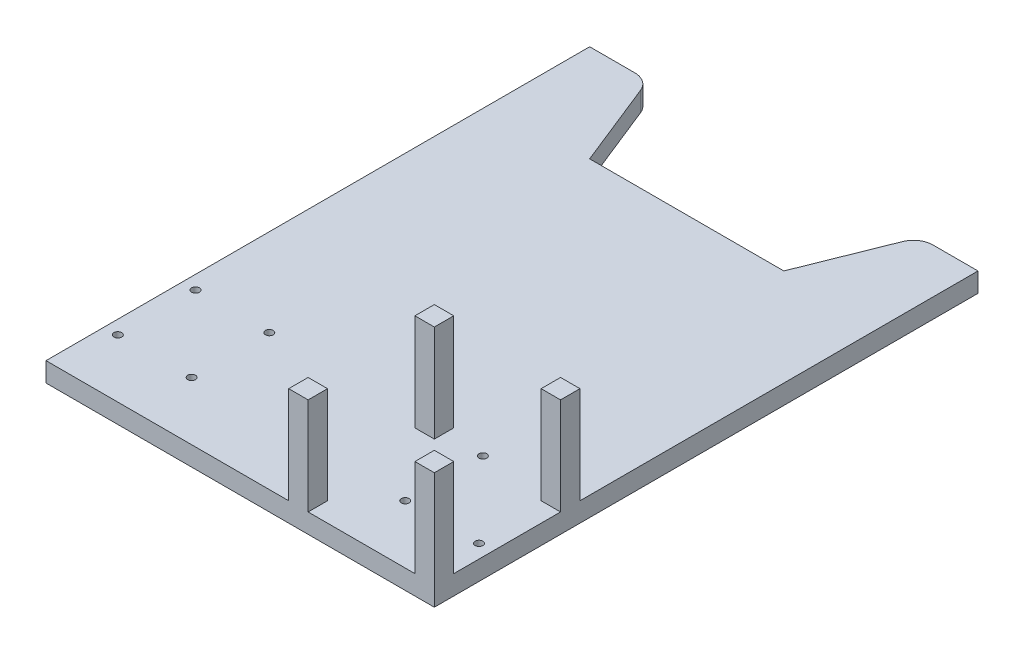
from build123d import *

# Parameters (mm, degrees)
SKETCH3_W           = 200
SKETCH3_H           = 280
BOSS_EXTRUDE1_DEPTH = 10
SKETCH4_W           = 10
SKETCH4_H           = 10
BOSS_EXTRUDE2_DEPTH = 50
SKETCH7_R           = 2
SKETCH7_R_2         = 2.000000006
SKETCH7_R_3         = 1.999999994
CUT_EXTRUDE2_DEPTH  = 10
CUT_EXTRUDE4_DEPTH  = 10
FILLET1_R           = 10


with BuildPart() as part:
    # Sketch3 → Boss-Extrude1 (new body)
    with BuildSketch(Plane(origin=(0, 0, 0), x_dir=(1, 0, 0), z_dir=(0, 1, 0))):
        Rectangle(SKETCH3_W, SKETCH3_H)
    extrude(amount=BOSS_EXTRUDE1_DEPTH)

    # Sketch4 → Boss-Extrude2 (add)
    with BuildSketch(Plane(origin=(0, 10, 0), x_dir=(1, 0, 0), z_dir=(0, 1, 0))):
        with Locations((95, -135)):
            Rectangle(SKETCH4_W, SKETCH4_H)
        with Locations((95, -70)):
            Rectangle(SKETCH4_W, SKETCH4_H)
        with Locations((30, -135)):
            Rectangle(SKETCH4_W, SKETCH4_H)
        with Locations((30, -70)):
            Rectangle(SKETCH4_W, SKETCH4_H)
    extrude(amount=BOSS_EXTRUDE2_DEPTH)

    # Sketch7 → Cut-Extrude2 (cut)
    with BuildSketch(Plane.XZ):
        with Locations((-93, 70)):
            Circle(SKETCH7_R)
        with Locations((-93, 110)):
            Circle(SKETCH7_R)
        with Locations((-55, 110)):
            Circle(SKETCH7_R_2)
        with Locations((-55, 70)):
            Circle(SKETCH7_R)
        with Locations((55, 110)):
            Circle(SKETCH7_R_3)
        with Locations((93, 110)):
            Circle(SKETCH7_R)
        with Locations((93, 70)):
            Circle(SKETCH7_R)
        with Locations((55, 70)):
            Circle(SKETCH7_R)
    extrude(amount=-CUT_EXTRUDE2_DEPTH, mode=Mode.SUBTRACT)

    # Sketch9 → Cut-Extrude4 (cut)
    with BuildSketch(Plane(origin=(0, 10, 0), x_dir=(1, 0, 0), z_dir=(0, 1, 0))):
        Polygon((50, 140), (-50, 140), (-70, 140), (-50, 90), (50, 90), (70, 140), align=None)
    extrude(amount=-CUT_EXTRUDE4_DEPTH, mode=Mode.SUBTRACT)

    # Fillet1
    fillet1_edges = [part.edges().sort_by_distance(p)[0] for p in [
        (-70, 5, -140),
        (70, 5, -140),
    ]]
    fillet(fillet1_edges, radius=FILLET1_R)


solid = part.part
